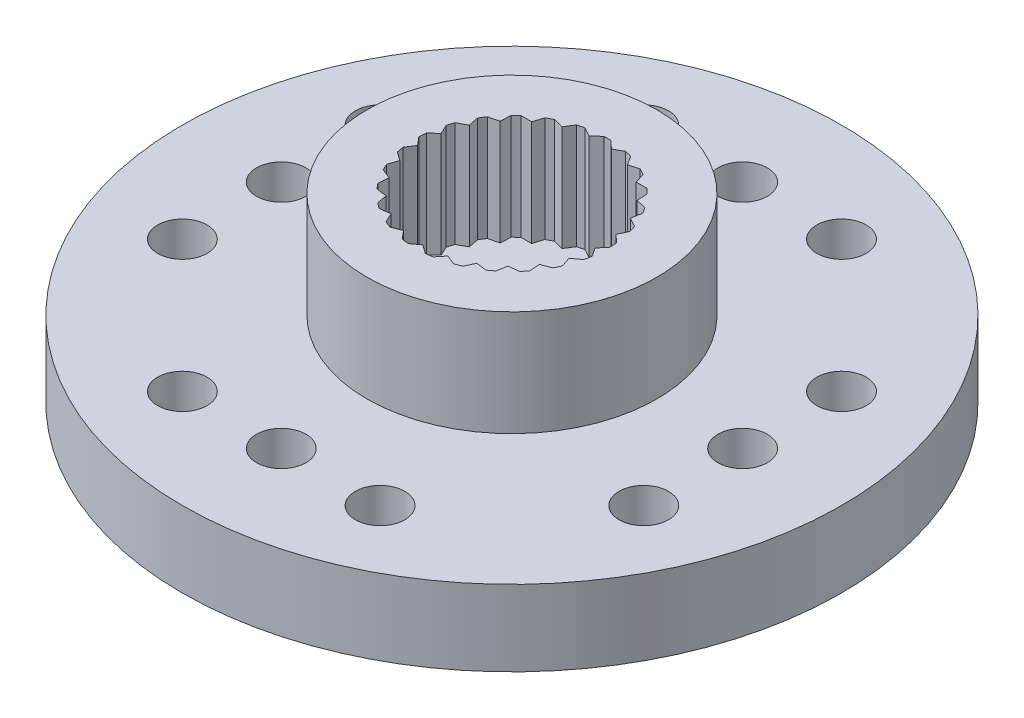
from build123d import *

# Parameters (mm, degrees)
SKETCH2_R           = 6
SKETCH2_R_2         = 1.5
BOSS_EXTRUDE1_DEPTH = 1.15
SKETCH3_R           = 4.4
BOSS_EXTRUDE2_DEPTH = 3.2
SKETCH5_R           = 10
SKETCH5_R_2         = 0.75
SKETCH5_R_3         = 1.5
BOSS_EXTRUDE4_DEPTH = 1.15


with BuildPart() as part:
    # Sketch2 → Boss-Extrude1 (new, symmetric)
    with BuildSketch(Plane(origin=(0, 0, 0), x_dir=(1, 0, 0), z_dir=(0, 1, 0))):
        Circle(SKETCH2_R)
        Circle(SKETCH2_R_2, mode=Mode.SUBTRACT)
    extrude(amount=BOSS_EXTRUDE1_DEPTH, both=True)

    # Sketch3 → Boss-Extrude2 (add)
    with BuildSketch(Plane(origin=(0, 1.15, 0), x_dir=(1, 0, 0), z_dir=(0, 1, 0))):
        Circle(SKETCH3_R)
        with BuildLine():
            Line((0.107421435, 2.898009771), (0.338399731, 2.678709694))
            Line((0.338399731, 2.678709694), (0.61665913, 2.83367809))
            ThreePointArc((0.61665913, 2.83367809), (0.721200673, 2.808891167), (0.824752316, 2.780248841))
            Line((0.824752316, 2.780248841), (0.993936292, 2.510396512))
            Line((0.993936292, 2.510396512), (1.301992734, 2.591295993))
            ThreePointArc((1.301992734, 2.591295993), (1.397085655, 2.541289372), (1.490260976, 2.48779465))
            Line((1.490260976, 2.48779465), (1.587020181, 2.184345885))
            Line((1.587020181, 2.184345885), (1.905517346, 2.186093238))
            ThreePointArc((1.905517346, 2.186093238), (1.985186607, 2.11400902), (2.062131058, 2.039023173))
            Line((2.062131058, 2.039023173), (2.080385755, 1.721044772))
            Line((2.080385755, 1.721044772), (2.389311295, 1.643530205))
            ThreePointArc((2.389311295, 1.643530205), (2.448550984, 1.553897705), (2.504429862, 1.46213237))
            Line((2.504429862, 1.46213237), (2.443033042, 1.149604087))
            Line((2.443033042, 1.149604087), (2.722976028, 0.997698125))
            ThreePointArc((2.722976028, 0.997698125), (2.758063897, 0.896149284), (2.789366126, 0.793370413))
            Line((2.789366126, 0.793370413), (2.652175577, 0.505929549))
            Line((2.652175577, 0.505929549), (2.885546163, 0.289177003))
            ThreePointArc((2.885546163, 0.289177003), (2.894277512, 0.182092507), (2.899036259, 0.074758075))
            Line((2.899036259, 0.074758075), (2.694672167, -0.169534403))
            Line((2.694672167, -0.169534403), (2.866806821, -0.437514174))
            ThreePointArc((2.866806821, -0.437514174), (2.848633027, -0.543405812), (2.826549281, -0.648551587))
            Line((2.826549281, -0.648551587), (2.567852594, -0.834345885))
            Line((2.567852594, -0.834345885), (2.667935462, -1.136714727))
            ThreePointArc((2.667935462, -1.136714727), (2.623998452, -1.234759946), (2.576459817, -1.331110368))
            Line((2.576459817, -1.331110368), (2.279685399, -1.446732346))
            Line((2.279685399, -1.446732346), (2.301427906, -1.764491312))
            ThreePointArc((2.301427906, -1.764491312), (2.234488404, -1.84852957), (2.164481907, -1.930030589))
            Line((2.164481907, -1.930030589), (1.848277186, -1.968215294))
            Line((1.848277186, -1.968215294), (1.790313171, -2.281398419))
            ThreePointArc((1.790313171, -2.281398419), (1.704577232, -2.346149284), (1.616501638, -2.40767989))
            Line((1.616501638, -2.40767989), (1.30073492, -2.366028036))
            Line((1.30073492, -2.366028036), (1.166706475, -2.654956874))
            ThreePointArc((1.166706475, -2.654956874), (1.067561203, -2.696351809), (0.966950626, -2.734045809))
            Line((0.966950626, -2.734045809), (0.671462695, -2.615174535))
            Line((0.671462695, -2.615174535), (0.469791321, -2.861694623))
            ThreePointArc((0.469791321, -2.861694623), (0.363466377, -2.877132634), (0.25664255, -2.888621575))
            Line((0.25664255, -2.888621575), (0, -2.7))
            Line((0, -2.7), (-0.25664255, -2.888621575))
            ThreePointArc((-0.25664255, -2.888621575), (-0.363466377, -2.877132634), (-0.469791321, -2.861694623))
            Line((-0.469791321, -2.861694623), (-0.671462695, -2.615174535))
            Line((-0.671462695, -2.615174535), (-0.966950626, -2.734045809))
            ThreePointArc((-0.966950626, -2.734045809), (-1.067561203, -2.696351809), (-1.166706475, -2.654956874))
            Line((-1.166706475, -2.654956874), (-1.30073492, -2.366028036))
            Line((-1.30073492, -2.366028036), (-1.616501638, -2.40767989))
            ThreePointArc((-1.616501638, -2.40767989), (-1.704577232, -2.346149284), (-1.790313171, -2.281398419))
            Line((-1.790313171, -2.281398419), (-1.848277186, -1.968215294))
            Line((-1.848277186, -1.968215294), (-2.164481907, -1.930030589))
            ThreePointArc((-2.164481907, -1.930030589), (-2.234488404, -1.84852957), (-2.301427906, -1.764491312))
            Line((-2.301427906, -1.764491312), (-2.279685399, -1.446732346))
            Line((-2.279685399, -1.446732346), (-2.576459817, -1.331110368))
            ThreePointArc((-2.576459817, -1.331110368), (-2.623998452, -1.234759946), (-2.667935462, -1.136714727))
            Line((-2.667935462, -1.136714727), (-2.567852594, -0.834345885))
            Line((-2.567852594, -0.834345885), (-2.826549281, -0.648551587))
            ThreePointArc((-2.826549281, -0.648551587), (-2.848633027, -0.543405812), (-2.866806821, -0.437514174))
            Line((-2.866806821, -0.437514174), (-2.694672167, -0.169534403))
            Line((-2.694672167, -0.169534403), (-2.899036259, 0.074758075))
            ThreePointArc((-2.899036259, 0.074758075), (-2.894277512, 0.182092507), (-2.885546163, 0.289177003))
            Line((-2.885546163, 0.289177003), (-2.652175577, 0.505929549))
            Line((-2.652175577, 0.505929549), (-2.789366126, 0.793370413))
            ThreePointArc((-2.789366126, 0.793370413), (-2.758063897, 0.896149284), (-2.722976028, 0.997698125))
            Line((-2.722976028, 0.997698125), (-2.443033042, 1.149604087))
            Line((-2.443033042, 1.149604087), (-2.504429862, 1.46213237))
            ThreePointArc((-2.504429862, 1.46213237), (-2.448550984, 1.553897705), (-2.389311295, 1.643530205))
            Line((-2.389311295, 1.643530205), (-2.080385755, 1.721044772))
            Line((-2.080385755, 1.721044772), (-2.062131058, 2.039023173))
            ThreePointArc((-2.062131058, 2.039023173), (-1.985186607, 2.11400902), (-1.905517346, 2.186093238))
            Line((-1.905517346, 2.186093238), (-1.587020181, 2.184345885))
            Line((-1.587020181, 2.184345885), (-1.490260976, 2.48779465))
            ThreePointArc((-1.490260976, 2.48779465), (-1.397085655, 2.541289372), (-1.301992734, 2.591295993))
            Line((-1.301992734, 2.591295993), (-0.993936292, 2.510396512))
            Line((-0.993936292, 2.510396512), (-0.824752316, 2.780248841))
            ThreePointArc((-0.824752316, 2.780248841), (-0.721200673, 2.808891167), (-0.61665913, 2.83367809))
            Line((-0.61665913, 2.83367809), (-0.338399731, 2.678709694))
            Line((-0.338399731, 2.678709694), (-0.107421435, 2.898009771))
            ThreePointArc((-0.107421435, 2.898009771), (0, 2.9), (0.107421435, 2.898009771))
        make_face(mode=Mode.SUBTRACT)
    extrude(amount=BOSS_EXTRUDE2_DEPTH)

    # Sketch5 → Boss-Extrude4 (add, symmetric)
    with BuildSketch(Plane(origin=(0, 0, 0), x_dir=(1, 0, 0), z_dir=(0, 1, 0))):
        Circle(SKETCH5_R)
        with Locations((0, 7)):
            Circle(SKETCH5_R_2, mode=Mode.SUBTRACT)
        with Locations((-3, 7)):
            Circle(SKETCH5_R_2, mode=Mode.SUBTRACT)
        with Locations((3, 7)):
            Circle(SKETCH5_R_2, mode=Mode.SUBTRACT)
        with Locations((7, 3)):
            Circle(SKETCH5_R_2, mode=Mode.SUBTRACT)
        with Locations((7, 0)):
            Circle(SKETCH5_R_2, mode=Mode.SUBTRACT)
        with Locations((7, -3)):
            Circle(SKETCH5_R_2, mode=Mode.SUBTRACT)
        with Locations((3, -7)):
            Circle(SKETCH5_R_2, mode=Mode.SUBTRACT)
        with Locations((0, -7)):
            Circle(SKETCH5_R_2, mode=Mode.SUBTRACT)
        with Locations((-3, -7)):
            Circle(SKETCH5_R_2, mode=Mode.SUBTRACT)
        with Locations((-7, -3)):
            Circle(SKETCH5_R_2, mode=Mode.SUBTRACT)
        with Locations((-7, 0)):
            Circle(SKETCH5_R_2, mode=Mode.SUBTRACT)
        with Locations((-7, 3)):
            Circle(SKETCH5_R_2, mode=Mode.SUBTRACT)
        Circle(SKETCH5_R_3, mode=Mode.SUBTRACT)
    extrude(amount=BOSS_EXTRUDE4_DEPTH, both=True)


solid = part.part
